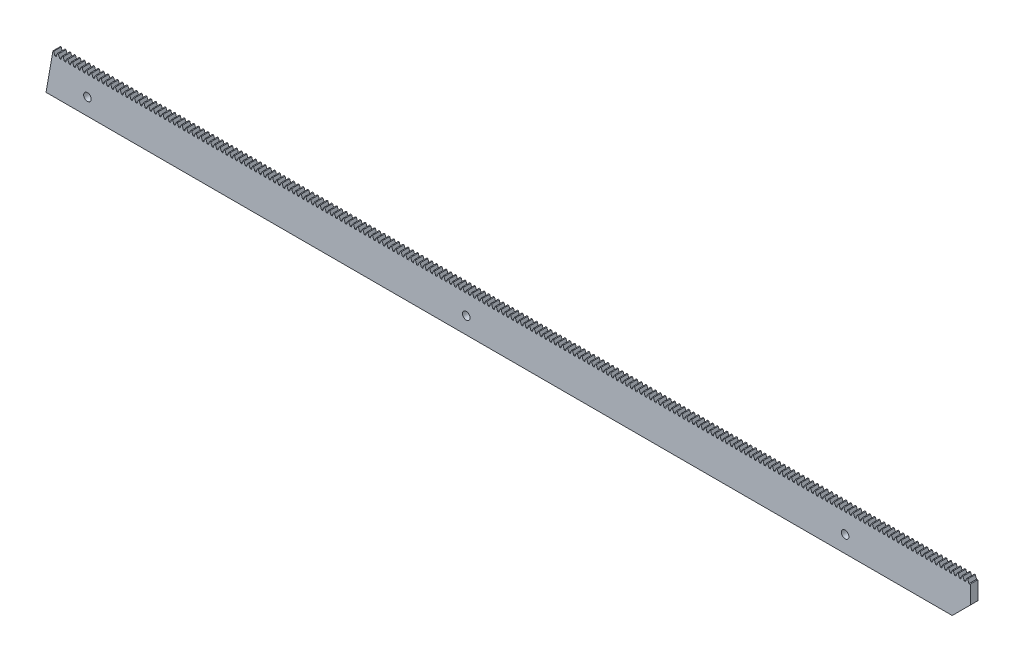
from build123d import *

# Parameters (mm, degrees)
BLANKSKE_W          = 1220
BLANKSKE_H          = 52
BLANK_DEPTH         = 10
TOOTHCUTSIM_DEPTH   = 1222.148639601
TEETHCUTS_COUNT     = 196
TEETHCUTS_PITCH     = 6.2831853
CUT_EXTRUDE_1_DEPTH = 1222.148639601
SKETCH_2_R          = 5
CUT_EXTRUDE_2_DEPTH = 1222.148639601
CUT_EXTRUDE_3_DEPTH = 1222.148639601


with BuildPart() as part:
    # BlankSke → Blank (new body)
    with BuildSketch(Plane.XY):
        with Locations((610, 26)):
            Rectangle(BLANKSKE_W, BLANKSKE_H)
    extrude(amount=-BLANK_DEPTH)

    # TooCutSkeSim → ToothCutSim (cut, through all)
    with BuildSketch(Plane.XY):
        Polygon((0.861870739, 47.5), (-0.861870739, 47.5), (-2.508981637, 52.0254), (2.508981637, 52.0254), align=None)
    toothcutsim = extrude(amount=-TOOTHCUTSIM_DEPTH, mode=Mode.SUBTRACT)

    # TeethCuts: ToothCutSim ×196
    with Locations(*[(i * TEETHCUTS_PITCH, 0, 0) for i in range(1, TEETHCUTS_COUNT)]):
        add(toothcutsim, mode=Mode.SUBTRACT)

    # Эскиз1 → Вырез-Вытянуть1 (cut, through all)
    with BuildSketch(Plane.XY):
        Polygon((0, 0), (11.672905757, 66.2003382), (0, 64.657724784), align=None)
    extrude(amount=-CUT_EXTRUDE_1_DEPTH, mode=Mode.SUBTRACT)

    # Эскиз2 → Вырез-Вытянуть2 (cut, through all)
    with BuildSketch(Plane.XY):
        with Locations((54.65052417, 22)):
            Circle(SKETCH_2_R)
        with Locations((554.65052417, 22)):
            Circle(SKETCH_2_R)
        with Locations((1054.65052417, 22)):
            Circle(SKETCH_2_R)
    extrude(amount=-CUT_EXTRUDE_2_DEPTH, mode=Mode.SUBTRACT)

    # Эскиз3 → Вырез-Вытянуть3 (cut, through all)
    with BuildSketch(Plane.XY):
        Polygon((1220, 24.024996472), (1195.975003528, 0), (1236.043890655, 0), align=None)
    extrude(amount=-CUT_EXTRUDE_3_DEPTH, mode=Mode.SUBTRACT)


solid = part.part
